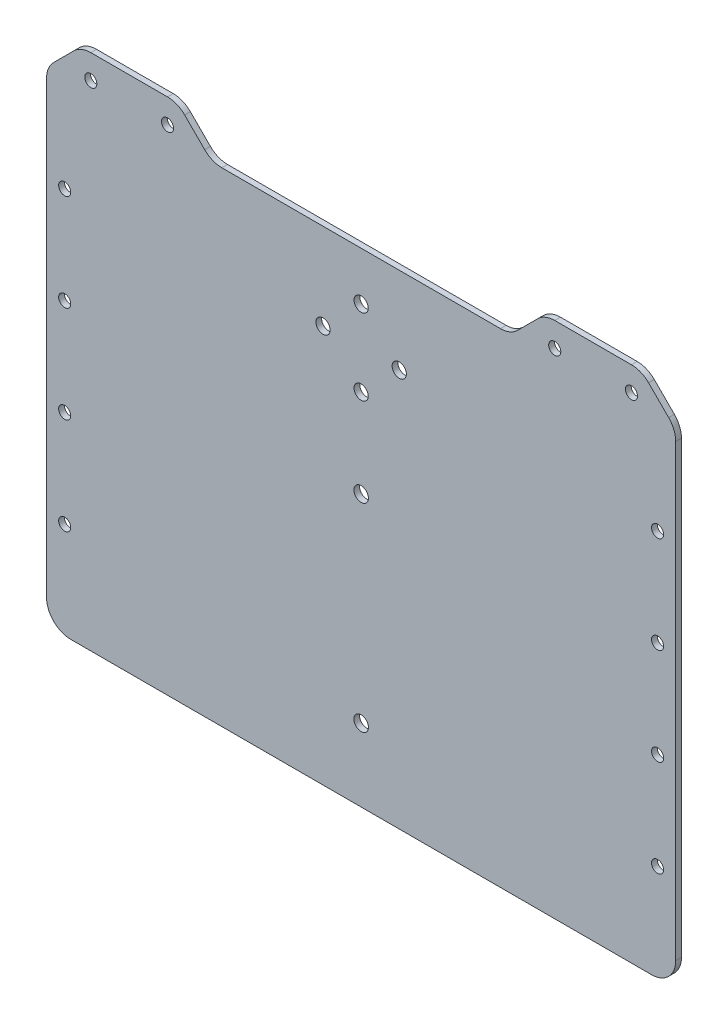
from build123d import *

# Parameters (mm, degrees)
SKETCH1_R           = 1.5875
BOSS_EXTRUDE1_DEPTH = 1.5
SKETCH2_R           = 1.906243542
CUT_EXTRUDE1_DEPTH  = 110.864189013
SKETCH3_R           = 1.8669
CUT_EXTRUDE2_DEPTH  = 110.864189013


with BuildPart() as part:
    # Sketch1 → Boss-Extrude1 (new body)
    with BuildSketch(Plane.XY):
        with BuildLine():
            Line((-82.55, 60.869743879), (-82.55, -57.15))
            ThreePointArc((-82.55, -57.15), (-80.690128061, -61.640128061), (-76.2, -63.5))
            Line((-76.2, -63.5), (76.2, -63.5))
            ThreePointArc((76.2, -63.5), (80.690128061, -61.640128061), (82.55, -57.15))
            Line((82.55, -57.15), (82.55, 60.869743879))
            ThreePointArc((82.55, 60.869743879), (82.066635031, 63.299783674), (80.690128061, 65.359871939))
            Line((80.690128061, 65.359871939), (75.429615818, 70.620384182))
            ThreePointArc((75.429615818, 70.620384182), (73.369527553, 71.996891153), (70.939487758, 72.480256121))
            Line((70.939487758, 72.480256121), (50.8, 72.480256121))
            ThreePointArc((50.8, 72.480256121), (48.369960204, 71.996891153), (46.309871939, 70.620384182))
            Line((46.309871939, 70.620384182), (41.049359697, 65.359871939))
            ThreePointArc((41.049359697, 65.359871939), (38.989271432, 63.983364969), (36.559231637, 63.5))
            Line((36.559231637, 63.5), (0, 63.5))
            Line((0, 63.5), (-36.559231637, 63.5))
            ThreePointArc((-36.559231637, 63.5), (-38.989271432, 63.983364969), (-41.049359697, 65.359871939))
            Line((-41.049359697, 65.359871939), (-46.309871939, 70.620384182))
            ThreePointArc((-46.309871939, 70.620384182), (-48.369960204, 71.996891153), (-50.8, 72.480256121))
            Line((-50.8, 72.480256121), (-70.939487758, 72.480256121))
            ThreePointArc((-70.939487758, 72.480256121), (-73.369527553, 71.996891153), (-75.429615818, 70.620384182))
            Line((-75.429615818, 70.620384182), (-80.690128061, 65.359871939))
            ThreePointArc((-80.690128061, 65.359871939), (-82.066635031, 63.299783674), (-82.55, 60.869743879))
        make_face()
        with Locations((-77.7875, -38.1)):
            Circle(SKETCH1_R, mode=Mode.SUBTRACT)
        with Locations((-77.7875, -12.7)):
            Circle(SKETCH1_R, mode=Mode.SUBTRACT)
        with Locations((-77.7875, 12.7)):
            Circle(SKETCH1_R, mode=Mode.SUBTRACT)
        with Locations((-77.7875, 38.1)):
            Circle(SKETCH1_R, mode=Mode.SUBTRACT)
        with Locations((77.7875, 38.1)):
            Circle(SKETCH1_R, mode=Mode.SUBTRACT)
        with Locations((77.7875, 12.7)):
            Circle(SKETCH1_R, mode=Mode.SUBTRACT)
        with Locations((77.7875, -12.7)):
            Circle(SKETCH1_R, mode=Mode.SUBTRACT)
        with Locations((77.7875, -38.1)):
            Circle(SKETCH1_R, mode=Mode.SUBTRACT)
        with Locations((-70.939487758, 66.130256121)):
            Circle(SKETCH1_R, mode=Mode.SUBTRACT)
        with Locations((-50.8, 66.130256121)):
            Circle(SKETCH1_R, mode=Mode.SUBTRACT)
        with Locations((50.8, 66.130256121)):
            Circle(SKETCH1_R, mode=Mode.SUBTRACT)
        with Locations((70.939487758, 66.130256121)):
            Circle(SKETCH1_R, mode=Mode.SUBTRACT)
    extrude(amount=BOSS_EXTRUDE1_DEPTH)

    # Sketch2 → Cut-Extrude1 (cut, through all)
    with BuildSketch(Plane.XY.offset(1.5)):
        with Locations((0, -44.45)):
            Circle(SKETCH2_R)
        with Locations((0, 7.633414375)):
            Circle(SKETCH2_R)
    extrude(amount=-CUT_EXTRUDE1_DEPTH, mode=Mode.SUBTRACT)

    # Sketch3 → Cut-Extrude2 (cut, through all)
    with BuildSketch(Plane.XY.offset(1.5)):
        with Locations((0, 50.8)):
            Circle(SKETCH3_R)
        with Locations((-10, 40.8)):
            Circle(SKETCH3_R)
        with Locations((0, 30.8)):
            Circle(SKETCH3_R)
        with Locations((10, 40.8)):
            Circle(SKETCH3_R)
    extrude(amount=-CUT_EXTRUDE2_DEPTH, mode=Mode.SUBTRACT)


solid = part.part
